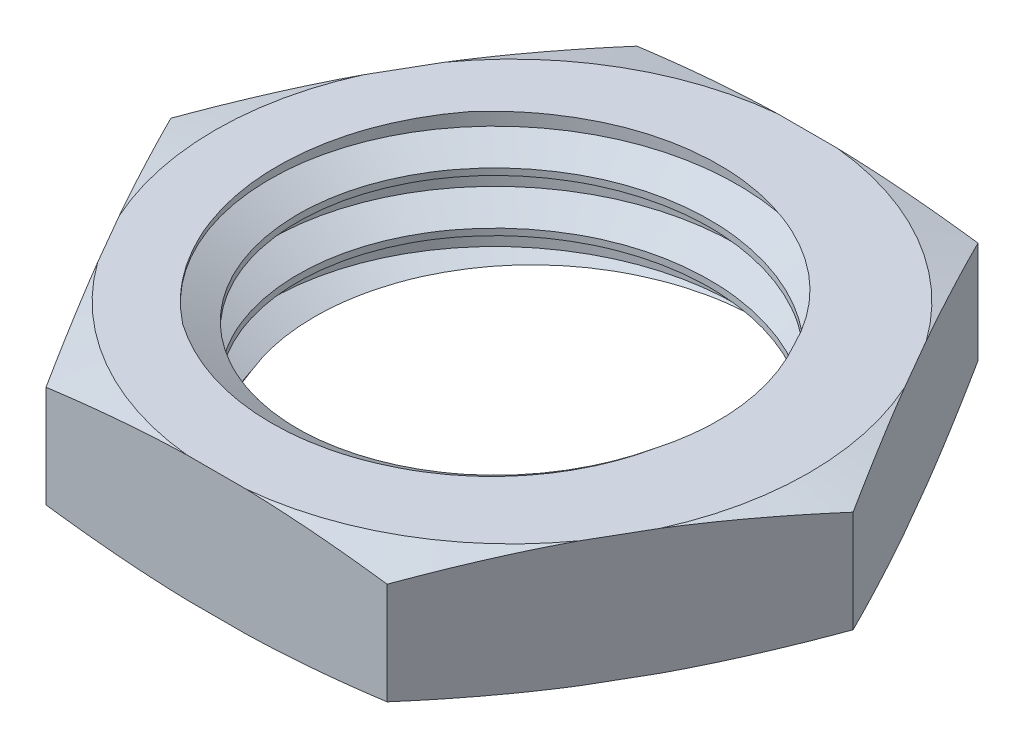
from build123d import *

# Parameters (mm, degrees)
SKETCH1_R               = 2.793
BOSS_EXTRUDE1_DEPTH     = 0.85
SKETCH6_OUTSIDE_W       = 26.394
SKETCH6_OUTSIDE_H       = 25.156
SKETCH6_OUTSIDE_R       = 4.02
CUT_EXTRUDE5_DEPTH      = 1.7
CUT_EXTRUDE5_DRAFT      = -75
MIRROR1_COPY_1_SKETCH_W = 26.394
MIRROR1_COPY_1_SKETCH_H = 25.156
MIRROR1_COPY_1_SKETCH_R = 4.02
MIRROR1_COPY_1_DEPTH    = 1.7
MIRROR1_COPY_1_DRAFT    = -75
THREAD1_PITCH           = 0.705555556


with BuildPart() as part:
    # Sketch1 → Boss-Extrude1 (new, symmetric)
    with BuildSketch(Plane(origin=(0, 0, 0), x_dir=(1, 0, 0), z_dir=(0, 1, 0))):
        Polygon((-4.618802154, 0), (-2.309401077, -4), (2.309401077, -4), (4.618802154, 0), (2.309401077, 4), (-2.309401077, 4), align=None)
        with Locations(Location((0, 0, 0), (0, 0, 270))):
            Circle(SKETCH1_R, mode=Mode.SUBTRACT)
    extrude(amount=BOSS_EXTRUDE1_DEPTH, both=True)


with BuildPart() as cut_extrude5_tool:
    # Sketch6 outside → Cut-Extrude5 (with draft: the straight prism first)
    with BuildSketch(Plane(origin=(0, 0.85, 0), x_dir=(1, 0, 0), z_dir=(0, 1, 0))):
        Rectangle(SKETCH6_OUTSIDE_W, SKETCH6_OUTSIDE_H)
        Circle(SKETCH6_OUTSIDE_R, mode=Mode.SUBTRACT)
    extrude(amount=-CUT_EXTRUDE5_DEPTH)
    # Cut-Extrude5: the draft: its side faces are tilted about the plane it starts from
    cut_extrude5_sides = [cut_extrude5_tool.faces().sort_by_distance(p)[0] for p in [
        (0, 0, 12.578),
        (13.197, 0, 0),
        (0, 0, -12.578),
        (-13.197, 0, 0),
        (-4.02, 0, 0),
    ]]
    draft(cut_extrude5_sides, Plane(origin=(0, 0.85, 0), x_dir=(1, 0, 0), z_dir=(0, 1, 0)), CUT_EXTRUDE5_DRAFT)


with BuildPart() as part_1:
    add(part.part)

    # Cut-Extrude5: cut by cut_extrude5_tool
    add(cut_extrude5_tool.part, mode=Mode.SUBTRACT)


with BuildPart() as mirror1_copy_1_tool:
    # Mirror1 copy 1 sketch → Mirror1 copy 1 (with draft: the straight prism first)
    with BuildSketch(Plane.XZ.offset(0.85)):
        Rectangle(MIRROR1_COPY_1_SKETCH_W, MIRROR1_COPY_1_SKETCH_H)
        Circle(MIRROR1_COPY_1_SKETCH_R, mode=Mode.SUBTRACT)
    extrude(amount=-MIRROR1_COPY_1_DEPTH)
    # Mirror1 copy 1: the draft: its side faces are tilted about the plane it starts from
    mirror1_copy_1_sides = [mirror1_copy_1_tool.faces().sort_by_distance(p)[0] for p in [
        (0, 0, 12.578),
        (13.197, 0, 0),
        (0, 0, -12.578),
        (-13.197, 0, 0),
        (-4.02, 0, 0),
    ]]
    draft(mirror1_copy_1_sides, Plane.XZ.offset(0.85), MIRROR1_COPY_1_DRAFT)


with BuildPart() as part_2:
    add(part_1.part)

    # Mirror1 copy 1: cut by mirror1_copy_1_tool
    add(mirror1_copy_1_tool.part, mode=Mode.SUBTRACT)

    # Thread1: the profile of Thread Profile1 profile screwed along a right-hand helix of 3.826772 turns, 6 arcs to a turn; built about Z, then put on its axis
    thread1_z = Axis((0, 0, 0), (0, 0, 1))
    thread1_corners = [(2.7927, 0, -0.000173205), (2.7927, 0, 0.617534314), (3.174893145, 0, 0.396874999), (3.174893145, 0, 0.22048611)]
    with BuildLine(mode=Mode.PRIVATE) as thread1_profile:
        Line(thread1_corners[0], thread1_corners[1])
        Line(thread1_corners[1], thread1_corners[2])
        Line(thread1_corners[2], thread1_corners[3])
        Line(thread1_corners[3], thread1_corners[0])
    thread1_cap = Face(thread1_profile.wire())
    thread1_turn_angles = [0, 30, 60, 90, 120, 150, 180, 210, 240, 270, 300, 330, 360]
    thread1_turn_weights = [1, 0.8660254037844387, 1, 0.8660254037844387, 1, 0.8660254037844387, 1, 0.8660254037844387, 1, 0.8660254037844387, 1, 0.8660254037844387, 1]
    thread1_turn_rails = [Edge.make_bspline([Vector(p[0], p[1], 0).rotate(thread1_z, thread1_turn_angles[k]) / thread1_turn_weights[k] + Vector(0, 0, p[2] + THREAD1_PITCH * thread1_turn_angles[k] / 360) for k in range(13)], [0, 0, 0, 1, 1, 2, 2, 3, 3, 4, 4, 5, 5, 6, 6, 6], 2, thread1_turn_weights) for p in thread1_corners]
    thread1_turn_sides = [Face.make_surface_from_curves(thread1_turn_rails[p[0]], thread1_turn_rails[p[1]]) for p in [(0, 1), (1, 2), (2, 3), (3, 0)]]
    thread1_last_angles = [1080, 1110, 1140, 1170, 1200, 1230, 1260, 1290, 1320, 1348.818897638, 1377.637795276]
    thread1_last_weights = [1, 0.8660254037844387, 1, 0.8660254037844387, 1, 0.8660254037844387, 1, 0.8660254037844387, 1, 0.8761477374946532, 1]
    thread1_last_rails = [Edge.make_bspline([Vector(p[0], p[1], 0).rotate(thread1_z, thread1_last_angles[k]) / thread1_last_weights[k] + Vector(0, 0, p[2] + THREAD1_PITCH * thread1_last_angles[k] / 360) for k in range(11)], [0, 0, 0, 1, 1, 2, 2, 3, 3, 4, 4, 5, 5, 5], 2, thread1_last_weights) for p in thread1_corners]
    thread1_last_sides = [Face.make_surface_from_curves(thread1_last_rails[p[0]], thread1_last_rails[p[1]]) for p in [(0, 1), (1, 2), (2, 3), (3, 0)]]
    thread1 = Plane(origin=(0, 1.85, 0), x_dir=(-1, 0, 0), z_dir=(0, -1, 0)) * Solid(Shell([*[p.moved(Location((0, 0, THREAD1_PITCH * i))) for i in range(3) for p in thread1_turn_sides], *thread1_last_sides, thread1_cap, thread1_cap.rotate(thread1_z, 1377.637795276).moved(Location((0, 0, THREAD1_PITCH * 1377.637795276 / 360)))]))
    add(thread1, mode=Mode.SUBTRACT)


solid = part_2.part
